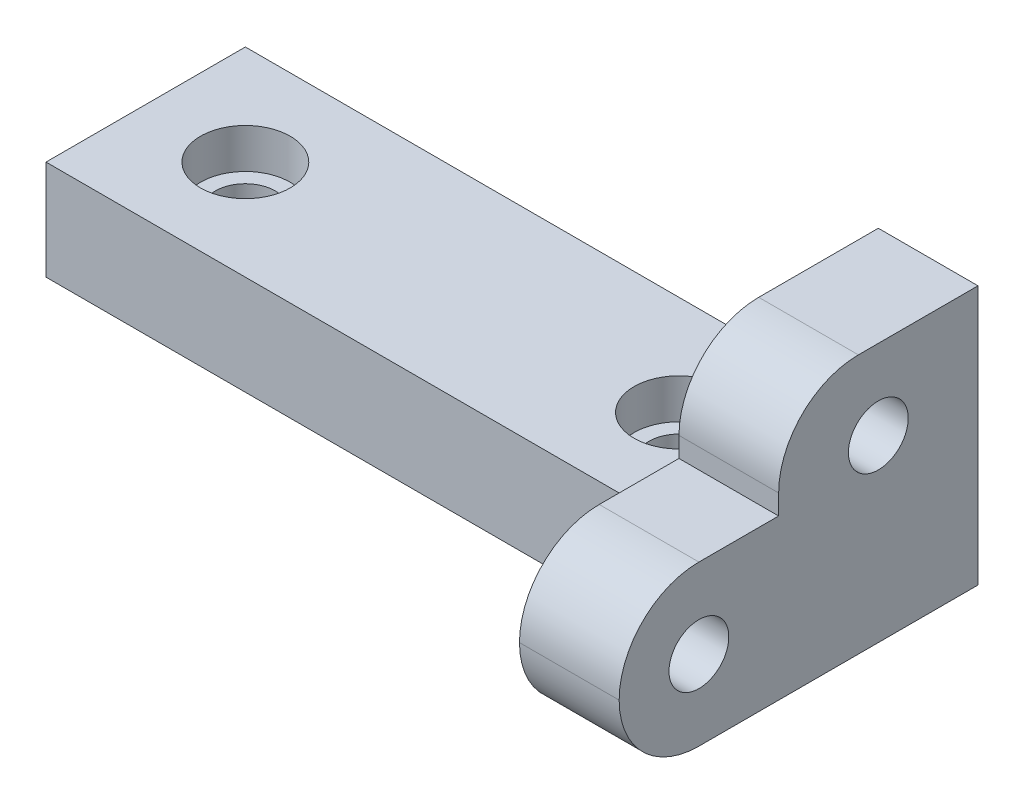
from build123d import *

# Parameters (mm, degrees)
SKETCH_4_W          = 36.75
SKETCH_4_H          = 10
EXTRUDE_1_DEPTH     = 5
EXTRUDE_START       = 5
SKETCH_4_3_W        = 5
SKETCH_4_3_H        = 10
EXTRUDE_2_DEPTH     = 8
SKETCH_5_W          = 5
SKETCH_5_H          = 13
EXTRUDE_3_DEPTH     = 8
SKETCH_6_R          = 1.5
SKETCH_6_W          = 8
SKETCH_6_H          = 5
CUT_EXTRUDE_1_DEPTH = 39.74354785
SKETCH_6_3_R        = 2.25
CUT_EXTRUDE_2_DEPTH = 2
SKETCH_7_R          = 2.25
CUT_EXTRUDE_3_DEPTH = 2
SKETCH_7_3_R        = 1.5
CUT_EXTRUDE_4_DEPTH = 42.696072957
FILLET_1_R          = 4


with BuildPart() as part:
    # 草图4 → 凸台-拉伸1 (new body)
    with BuildSketch(Plane(origin=(0, 0, 0), x_dir=(1, 0, 0), z_dir=(0, 1, 0))):
        with Locations((-18.375, -5)):
            Rectangle(SKETCH_4_W, SKETCH_4_H)
    extrude(amount=EXTRUDE_1_DEPTH)

    # 草图4<3> → 凸台-拉伸2 (add)
    with BuildSketch(Plane(origin=(0, 0, 0), x_dir=(1, 0, 0), z_dir=(0, 1, 0)).offset(EXTRUDE_START)):
        with Locations((-2.5, -5)):
            Rectangle(SKETCH_4_3_W, SKETCH_4_3_H)
    extrude(amount=EXTRUDE_2_DEPTH)

    # 草图5 → 凸台-拉伸3 (add)
    with BuildSketch(Plane.XY.offset(10)):
        with Locations((-2.5, 6.5)):
            Rectangle(SKETCH_5_W, SKETCH_5_H)
    extrude(amount=EXTRUDE_3_DEPTH)

    # 草图6 → 切除-拉伸1 (cut, through all)
    with BuildSketch(Plane.ZY.offset(5)):
        with Locations((5, 9)):
            Circle(SKETCH_6_R)
        with Locations((14, 4)):
            Circle(SKETCH_6_R)
        with Locations((14, 10.5)):
            Rectangle(SKETCH_6_W, SKETCH_6_H)
    extrude(amount=-CUT_EXTRUDE_1_DEPTH, mode=Mode.SUBTRACT)

    # 草图6<3> → 切除-拉伸2 (cut)
    with BuildSketch(Plane.ZY.offset(5)):
        with Locations((5, 9)):
            Circle(SKETCH_6_3_R)
        with Locations((14, 4)):
            Circle(SKETCH_6_3_R)
    extrude(amount=-CUT_EXTRUDE_2_DEPTH, mode=Mode.SUBTRACT)

    # 草图7 → 切除-拉伸3 (cut)
    with BuildSketch(Plane(origin=(0, 5, 0), x_dir=(1, 0, 0), z_dir=(0, 1, 0))):
        with Locations(Location((-31.75, -5, 0), (0, 0, 270))):
            Circle(SKETCH_7_R)
        with Locations(Location((-10, -5, 0), (0, 0, 270))):
            Circle(SKETCH_7_R)
    extrude(amount=-CUT_EXTRUDE_3_DEPTH, mode=Mode.SUBTRACT)

    # 草图7<3> → 切除-拉伸4 (cut, through all)
    with BuildSketch(Plane(origin=(0, 5, 0), x_dir=(1, 0, 0), z_dir=(0, 1, 0))):
        with Locations(Location((-31.75, -5, 0), (0, 0, 270))):
            Circle(SKETCH_7_3_R)
        with Locations(Location((-10, -5, 0), (0, 0, 270))):
            Circle(SKETCH_7_3_R)
    extrude(amount=-CUT_EXTRUDE_4_DEPTH, mode=Mode.SUBTRACT)

    # 圆角1
    fillet_1_edges = [part.edges().sort_by_distance(p)[0] for p in [
        (-2.5, 13, 10),
        (-2.5, 0, 18),
        (-2.5, 8, 18),
    ]]
    fillet(fillet_1_edges, radius=FILLET_1_R - 0.0001)  # a hair under: the kernel refuses the full size


solid = part.part
